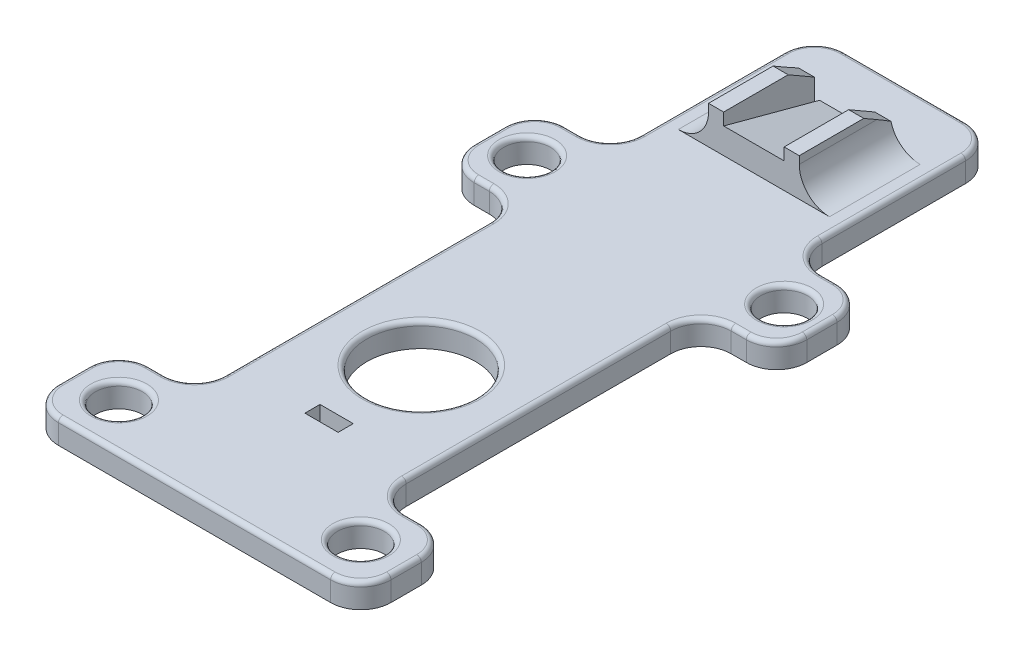
from build123d import *
from OCP.BRepFilletAPI import BRepFilletAPI_MakeChamfer

# Parameters (mm, degrees)
SKETCH1_W           = 12
SKETCH1_H           = 46
BOSS_EXTRUDE1_DEPTH = 1.6
SKETCH2_R           = 3.6
CUT_EXTRUDE1_DEPTH  = 33.596932371
SKETCH5_W           = 22
SKETCH5_H           = 6
BOSS_EXTRUDE4_DEPTH = 1.6
SKETCH6_R           = 1.55
CUT_EXTRUDE2_DEPTH  = 34.875654975
FILLET1_R           = 2
FILLET2_R           = 0.3
SKETCH8_W           = 1
SKETCH8_H           = 6
BOSS_EXTRUDE6_DEPTH = 2.5
BOSS_EXTRUDE7_DEPTH = 4
SKETCH10_W          = 2.2
SKETCH10_H          = 1
CUT_EXTRUDE3_DEPTH  = 35.085334122
CHAMFER1_SIZE       = 1
CHAMFER1_SIZE2      = 1.732050808
FILLET5_R           = 2


with BuildPart() as part:
    # Sketch1 → Boss-Extrude1 (new body)
    with BuildSketch(Plane(origin=(0, 0, 0), x_dir=(1, 0, 0), z_dir=(0, 1, 0))):
        with Locations((0, 9)):
            Rectangle(SKETCH1_W, SKETCH1_H)
    extrude(amount=BOSS_EXTRUDE1_DEPTH)

    # Sketch2 → Cut-Extrude1 (cut, through all)
    with BuildSketch(Plane(origin=(0, 0, 0), x_dir=(1, 0, 0), z_dir=(0, 1, 0))):
        with Locations(Location((0, 0, 0), (0, 0, 270))):
            Circle(SKETCH2_R)
    extrude(amount=CUT_EXTRUDE1_DEPTH, mode=Mode.SUBTRACT)

    # Sketch5 → Boss-Extrude4 (add)
    with BuildSketch(Plane(origin=(0, 1.6, 0), x_dir=(1, 0, 0), z_dir=(0, 1, 0))):
        with Locations((0, 15.5)):
            Rectangle(SKETCH5_W, SKETCH5_H)
        with Locations((0, -12)):
            Rectangle(SKETCH5_W, SKETCH5_H)
    extrude(amount=-BOSS_EXTRUDE4_DEPTH)

    # Sketch6 → Cut-Extrude2 (cut, through all)
    with BuildSketch(Plane(origin=(0, 1.6, 0), x_dir=(1, 0, 0), z_dir=(0, 1, 0))):
        with Locations(Location((-8.5, 15.5, 0), (0, 0, 270))):
            Circle(SKETCH6_R)
        with Locations(Location((8.5, 15.5, 0), (0, 0, 270))):
            Circle(SKETCH6_R)
        with Locations(Location((8, -12, 0), (0, 0, 270))):
            Circle(SKETCH6_R)
        with Locations(Location((-8, -12, 0), (0, 0, 270))):
            Circle(SKETCH6_R)
    extrude(amount=-CUT_EXTRUDE2_DEPTH, mode=Mode.SUBTRACT)

    # Fillet1
    fillet1_edges = [part.edges().sort_by_distance(p)[0] for p in [
        (11, 0.8, -12.5),
        (-11, 0.8, -18.5),
        (11, 0.8, -18.5),
        (6, 0.8, -12.5),
        (-6, 0.8, -12.5),
        (-11, 0.8, -12.5),
        (6, 0.8, -18.5),
        (-6, 0.8, -18.5),
        (-11, 0.8, 9),
        (11, 0.8, 9),
        (11, 0.8, 15),
        (-11, 0.8, 15),
        (6, 0.8, 9),
        (-6, 0.8, 9),
        (-6, 0.8, -32),
        (6, 0.8, -32),
    ]]
    fillet(fillet1_edges, radius=FILLET1_R)

    # Fillet2
    fillet2_edges = [part.edges().sort_by_distance(p)[0] for p in [
        (-10.414213562, 1.6, -17.914213562),
        (10.414213562, 1.6, -17.914213562),
        (10.414213562, 1.6, -13.085786438),
        (-5.414213562, 1.6, -31.414213562),
        (5.414213562, 1.6, -31.414213562),
        (-10.414213562, 1.6, 9.585786438),
        (-10.414213562, 1.6, 14.414213562),
        (10.414213562, 1.6, 9.585786438),
        (10.414213562, 1.6, 14.414213562),
        (6.585786438, 1.6, 8.414213562),
        (-6.585786438, 1.6, 8.414213562),
        (6.585786438, 1.6, -11.914213562),
        (6.585786438, 1.6, -19.085786438),
        (-6.585786438, 1.6, -19.085786438),
        (-6.585786438, 1.6, -11.914213562),
        (0, 1.6, -3.6),
        (-8, 1.6, 10.45),
        (8, 1.6, 10.45),
        (8.5, 1.6, -17.05),
        (-8.5, 1.6, -17.05),
        (0, 1.6, 15),
        (8.5, 1.6, 9),
        (6, 1.6, -1.75),
        (8.5, 1.6, -12.5),
        (11, 1.6, -15.5),
        (8.5, 1.6, -18.5),
        (6, 1.6, -25.25),
        (0, 1.6, -32),
        (-6, 1.6, -25.25),
        (-8.5, 1.6, -18.5),
        (-11, 1.6, -15.5),
        (-8.5, 1.6, -12.5),
        (-6, 1.6, -1.75),
        (-8.5, 1.6, 9),
        (-11, 1.6, 12),
        (11, 1.6, 12),
        (-10.414213562, 1.6, -13.085786438),
    ]]
    fillet(fillet2_edges, radius=FILLET2_R)

    # Sketch8 → Boss-Extrude6 (add)
    with BuildSketch(Plane(origin=(0, 1.6, 0), x_dir=(1, 0, 0), z_dir=(0, 1, 0))):
        with Locations((-2.5, 25)):
            Rectangle(SKETCH8_W, SKETCH8_H)
        with Locations((2.5, 25)):
            Rectangle(SKETCH8_W, SKETCH8_H)
    extrude(amount=BOSS_EXTRUDE6_DEPTH)

    # Sketch9 → Boss-Extrude7 (add)
    with BuildSketch(Plane(origin=(-2, 0, 0), x_dir=(0, 0, -1), z_dir=(1, 0, 0))):
        Polygon((22, 1.6), (28.344486373, 1.6), (22, 3.3), align=None)
    extrude(amount=BOSS_EXTRUDE7_DEPTH)

    # Sketch10 → Cut-Extrude3 (cut, through all)
    with BuildSketch(Plane.XZ):
        with Locations((0, 6.1)):
            Rectangle(SKETCH10_W, SKETCH10_H)
    extrude(amount=-CUT_EXTRUDE3_DEPTH, mode=Mode.SUBTRACT)

    # Chamfer1: one chamfer whose edges measure the first distance from different faces: ONE call of the kernel's chamfer builder (chamfer() names one face for all edges)
    chamfer1_edges_1 = [part.edges().sort_by_distance(p)[0] for p in [
        (-2.5, 4.1, -28),
    ]]
    chamfer1_side_1 = [part.faces().sort_by_distance(p)[0] for p in [
        (-2.5, 2.85, -28),
    ]]
    chamfer1_edges_2 = [part.edges().sort_by_distance(p)[0] for p in [
        (2.5, 4.1, -28),
    ]]
    chamfer1_side_2 = [part.faces().sort_by_distance(p)[0] for p in [
        (2.5, 2.85, -28),
    ]]
    chamfer1 = BRepFilletAPI_MakeChamfer(part.part.solid().wrapped)
    for e in chamfer1_edges_1:
        chamfer1.Add(CHAMFER1_SIZE, CHAMFER1_SIZE2, e.wrapped, chamfer1_side_1[0].wrapped)  # the first distance lies on this face
    for e in chamfer1_edges_2:
        chamfer1.Add(CHAMFER1_SIZE, CHAMFER1_SIZE2, e.wrapped, chamfer1_side_2[0].wrapped)  # the first distance lies on this face
    add(Compound.cast(chamfer1.Shape()), mode=Mode.REPLACE)

    # Fillet5
    # the kernel refuses this fillet: 2 mm, written as the material it adds along each edge
    with BuildSketch(Plane(origin=(3, 1.6, -22), x_dir=(0, 1, 0), z_dir=(0, 0, -1))) as fillet5_piece_1_section:
        with BuildLine():
            CenterArc((FILLET5_R, FILLET5_R), FILLET5_R, 180, 90)
            Line((0, FILLET5_R), (0, 0))
            Line((0, 0), (FILLET5_R, 0))
        make_face()
    fillet5_piece_1 = extrude(amount=6, mode=Mode.PRIVATE)
    fillet5_piece_1 = split(fillet5_piece_1, bisect_by=Plane(origin=(3.453623977, 4.138749703, -26.200832738), z_dir=(0, -0.8660254037844397, 0.4999999999999982)), keep=Keep.TOP, mode=Mode.PRIVATE)
    add(fillet5_piece_1)
    with BuildSketch(Plane(origin=(-3, 1.6, -28), x_dir=(-1, 0, 0), z_dir=(0, 0, 1))) as fillet5_piece_2_section:
        with BuildLine():
            CenterArc((FILLET5_R, -FILLET5_R), FILLET5_R, 90, 90)
            Line((0, -FILLET5_R), (0, 0))
            Line((0, 0), (FILLET5_R, 0))
        make_face()
    fillet5_piece_2 = extrude(amount=6, mode=Mode.PRIVATE)
    fillet5_piece_2 = split(fillet5_piece_2, bisect_by=Plane(origin=(-3.453623978, 4.138749702, -26.200832739), z_dir=(0, -0.8660254037844397, 0.4999999999999982)), keep=Keep.TOP, mode=Mode.PRIVATE)
    add(fillet5_piece_2)


solid = part.part
